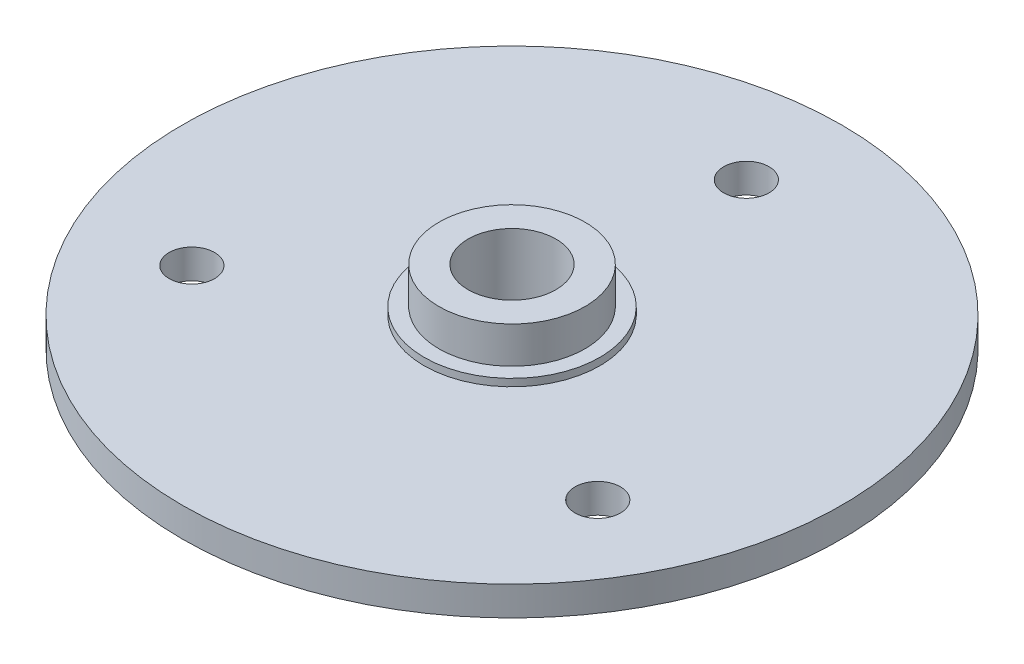
from build123d import *

# Parameters (mm, degrees)
SKETCH_1_R          = 22.5
SKETCH_1_R_2        = 1.55
EXTRUDE_1_DEPTH     = 2
SKETCH_2_R          = 4.99
EXTRUDE_2_DEPTH     = 3
SKETCH_3_R          = 6
EXTRUDE_3_DEPTH     = 0.5
SKETCH_4_R          = 3
CUT_EXTRUDE_1_DEPTH = 33.210246817


with BuildPart() as part:
    # ｽｹｯﾁ1 → ﾎﾞｽ - 押し出し1 (new body)
    with BuildSketch(Plane(origin=(0, 0, 0), x_dir=(1, 0, 0), z_dir=(0, 1, 0))):
        Circle(SKETCH_1_R)
        with Locations((0, 16)):
            Circle(SKETCH_1_R_2, mode=Mode.SUBTRACT)
        with Locations((13.856406461, -8)):
            Circle(SKETCH_1_R_2, mode=Mode.SUBTRACT)
        with Locations((-13.856406461, -8)):
            Circle(SKETCH_1_R_2, mode=Mode.SUBTRACT)
    extrude(amount=EXTRUDE_1_DEPTH)

    # ｽｹｯﾁ2 → ﾎﾞｽ - 押し出し2 (add)
    with BuildSketch(Plane(origin=(0, 2, 0), x_dir=(1, 0, 0), z_dir=(0, 1, 0))):
        Circle(SKETCH_2_R)
    extrude(amount=EXTRUDE_2_DEPTH)

    # ｽｹｯﾁ3 → ﾎﾞｽ - 押し出し3 (add)
    with BuildSketch(Plane(origin=(0, 2, 0), x_dir=(1, 0, 0), z_dir=(0, 1, 0))):
        Circle(SKETCH_3_R)
    extrude(amount=EXTRUDE_3_DEPTH)

    # ｽｹｯﾁ4 → ｶｯﾄ - 押し出し1 (cut, through all)
    with BuildSketch(Plane(origin=(0, 5, 0), x_dir=(1, 0, 0), z_dir=(0, 1, 0))):
        Circle(SKETCH_4_R)
    extrude(amount=-CUT_EXTRUDE_1_DEPTH, mode=Mode.SUBTRACT)


solid = part.part
